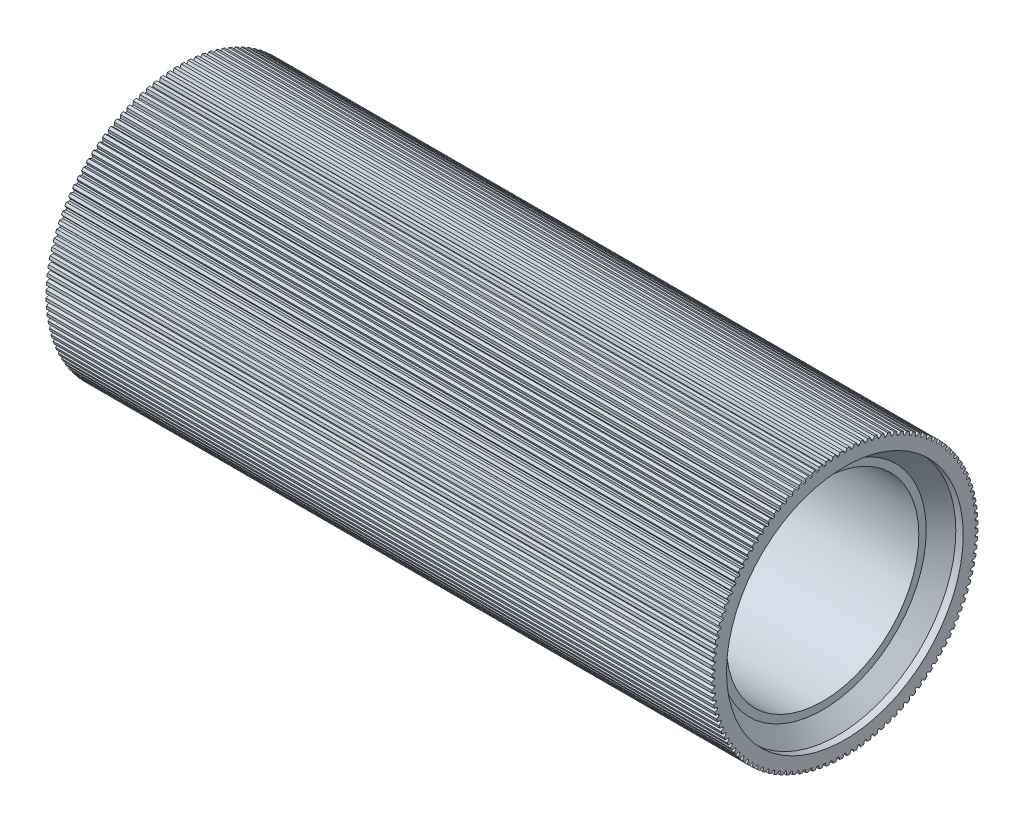
from build123d import *

# Parameters (mm, degrees)
CHAMFER2_SIZE      = 10
CUT_EXTRUDE2_DEPTH = 468.653718044
CIRPATTERN3_COUNT  = 120


with BuildPart() as part:
    # Sketch1 → Revolve1 (revolve)
    with BuildSketch(Plane.XY):
        Polygon((0, 90), (0, 80), (15, 80), (15, 65), (435, 65), (435, 80), (450, 80), (450, 90), align=None)
    revolve(axis=Axis((0, 0, 0), (1, 0, 0)))

    # Chamfer2
    chamfer2_edges = [part.edges().sort_by_distance(p)[0] for p in [
        (435, -80, 0),
    ]]
    chamfer(chamfer2_edges, length=CHAMFER2_SIZE)

    # Sketch4 → Cut-Extrude2 (cut, through all)
    with BuildSketch(Plane(origin=(0, 0, 0), x_dir=(0, 0, -1), z_dir=(1, 0, 0))):
        Polygon((-0.5, 88), (0.5, 88), (1.5, 90.291287847), (-1.5, 90.291287847), align=None)
    cut_extrude2 = extrude(amount=CUT_EXTRUDE2_DEPTH, mode=Mode.SUBTRACT)

    # CirPattern3: Cut-Extrude2 ×120 about axis
    cirpattern3_axis = Axis((450, 0, 0), (-1, 0, 0))
    for i in range(1, CIRPATTERN3_COUNT):
        add(cut_extrude2.rotate(cirpattern3_axis, i * 360 / CIRPATTERN3_COUNT), mode=Mode.SUBTRACT)


solid = part.part
